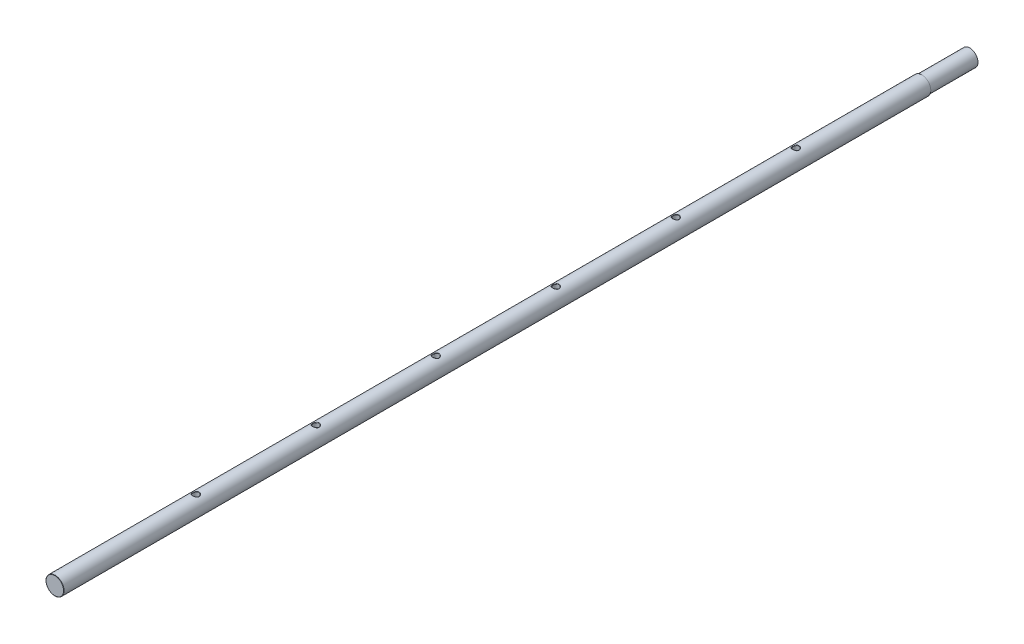
from build123d import *

# Parameters (mm, degrees)
SKETCH1_R              = 3
EXTRUDE1_DEPTH         = 305
FILLET1_R              = 0.1
CUT_EXTRUDE1_START     = 4
SKETCH2_R              = 1
CUT_EXTRUDE1_DEPTH     = 8
FILLET2_R              = 0.1
LPATTERN1_COUNT        = 6
LPATTERN1_PITCH        = 40
FILLET2_OF_LPATTERN1_R = 0.1
SKETCH3_R              = 3.249638233
SKETCH3_R_2            = 2.75
CUT_EXTRUDE2_DEPTH     = 16


with BuildPart() as part:
    # Sketch1 → Extrude1 (new body)
    with BuildSketch(Plane.XY):
        Circle(SKETCH1_R)
    extrude(amount=EXTRUDE1_DEPTH)

    # Fillet1
    fillet1_edges = [part.edges().sort_by_distance(p)[0] for p in [
        (-3, 0, 305),
    ]]
    fillet(fillet1_edges, radius=FILLET1_R)

    # Sketch2 → Cut-Extrude1 (cut)
    with BuildSketch(Plane(origin=(0, 0, 0), x_dir=(1, 0, 0), z_dir=(0, 1, 0)).offset(CUT_EXTRUDE1_START)):
        with Locations(Location((0, -58, 0), (0, 0, 270))):
            Circle(SKETCH2_R)
    cut_extrude1 = extrude(amount=-CUT_EXTRUDE1_DEPTH, mode=Mode.SUBTRACT)

    # Fillet2
    fillet2_edges = [part.edges().sort_by_distance(p)[0] for p in [
        (0, 3.000000001, 57.000000001),
        (0, -3.000000001, 57.000000001),
    ]]
    fillet(fillet2_edges, radius=FILLET2_R)

    # LPattern1: Cut-Extrude1 ×6
    with Locations(*[(0, 0, i * LPATTERN1_PITCH) for i in range(1, LPATTERN1_COUNT)]):
        add(cut_extrude1, mode=Mode.SUBTRACT)

    # Fillet2 of LPattern1
    fillet2_of_lpattern1_edges = [part.edges().sort_by_distance(p)[0] for p in [
        (0, 3.000000001, 97.000000001),
        (0, -3.000000001, 97.000000001),
        (0, 3.000000001, 137.000000001),
        (0, -3.000000001, 137.000000001),
        (0, 3.000000001, 177.000000001),
        (0, -3.000000001, 177.000000001),
        (0, 3.000000001, 217.000000001),
        (0, -3.000000001, 217.000000001),
        (0, 3.000000001, 257.000000001),
        (0, -3.000000001, 257.000000001),
    ]]
    fillet(fillet2_of_lpattern1_edges, radius=FILLET2_OF_LPATTERN1_R)

    # Sketch3 → Cut-Extrude2 (cut)
    with BuildSketch(Plane(origin=(0, 0, 0), x_dir=(-1, 0, 0), z_dir=(0, 0, -1))):
        Circle(SKETCH3_R)
        Circle(SKETCH3_R_2, mode=Mode.SUBTRACT)
    extrude(amount=-CUT_EXTRUDE2_DEPTH, mode=Mode.SUBTRACT)


solid = part.part
